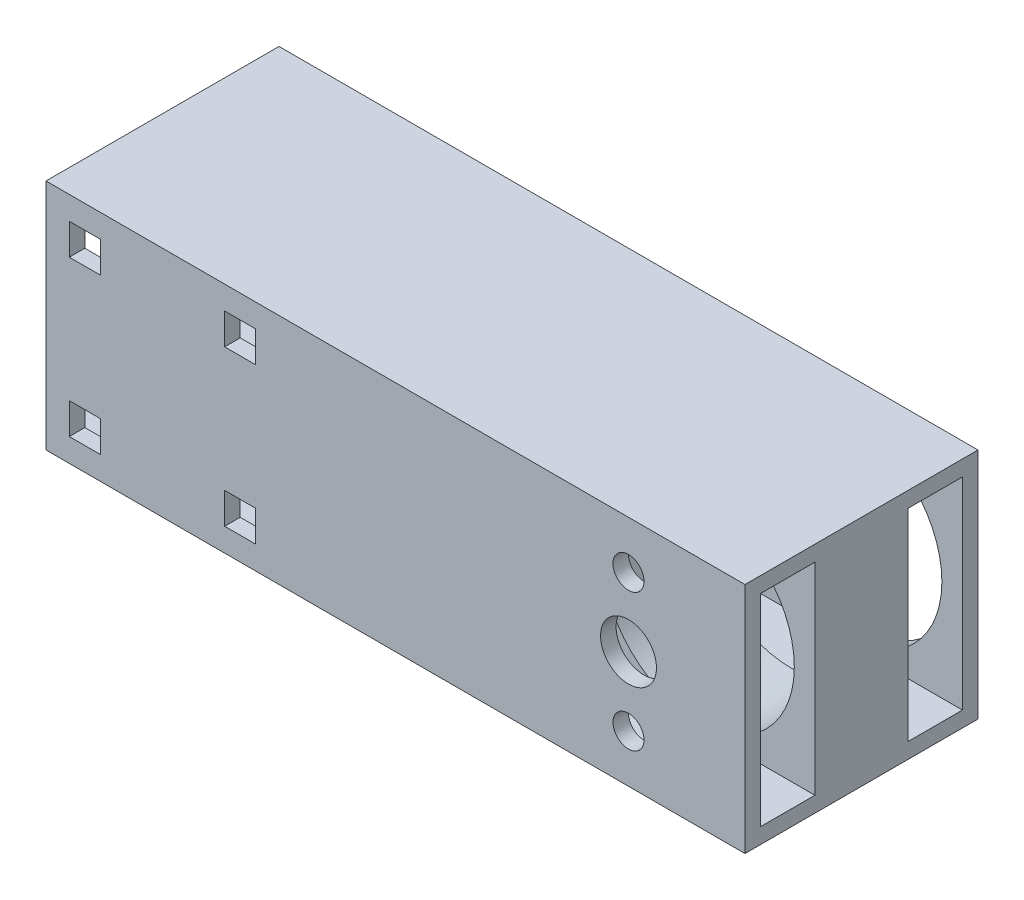
from build123d import *

# Parameters (mm, degrees)
SKETCH1_W           = 30
SKETCH1_H           = 30
SKETCH1_W_2         = 7
SKETCH1_H_2         = 26
BOSS_EXTRUDE3_DEPTH = 90
SKETCH6_R           = 12.35
CUT_EXTRUDE5_DEPTH  = 23
SKETCH8_R           = 3.6
SKETCH8_R_2         = 2
CUT_EXTRUDE6_DEPTH  = 17
SKETCH9_W           = 12
SKETCH9_H           = 26
CUT_EXTRUDE7_DEPTH  = 59
SKETCH10_W          = 4
SKETCH10_H          = 4
CUT_EXTRUDE8_DEPTH  = 34


with BuildPart() as part:
    # Sketch1 → Boss-Extrude3 (new body)
    with BuildSketch(Plane(origin=(0, 0, 0), x_dir=(0, 0, -1), z_dir=(1, 0, 0))):
        Rectangle(SKETCH1_W, SKETCH1_H)
        with Locations((-9.5, 0)):
            Rectangle(SKETCH1_W_2, SKETCH1_H_2, mode=Mode.SUBTRACT)
        with Locations((9.5, 0)):
            Rectangle(SKETCH1_W_2, SKETCH1_H_2, mode=Mode.SUBTRACT)
    extrude(amount=BOSS_EXTRUDE3_DEPTH)

    # Sketch6 → Cut-Extrude5 (cut)
    with BuildSketch(Plane(origin=(0, 0, -15), x_dir=(-1, 0, 0), z_dir=(0, 0, -1))):
        with Locations((-75, 0)):
            Circle(SKETCH6_R)
    extrude(amount=-CUT_EXTRUDE5_DEPTH, mode=Mode.SUBTRACT)

    # Sketch8 → Cut-Extrude6 (cut)
    with BuildSketch(Plane.XY.offset(15)):
        with Locations((75, 0)):
            Circle(SKETCH8_R)
        with Locations((75, 8.85)):
            Circle(SKETCH8_R_2)
        with Locations((75, -8.85)):
            Circle(SKETCH8_R_2)
    extrude(amount=-CUT_EXTRUDE6_DEPTH, mode=Mode.SUBTRACT)

    # Sketch9 → Cut-Extrude7 (cut)
    with BuildSketch(Plane.ZY):
        Rectangle(SKETCH9_W, SKETCH9_H)
    extrude(amount=-CUT_EXTRUDE7_DEPTH, mode=Mode.SUBTRACT)

    # Sketch10 → Cut-Extrude8 (cut)
    with BuildSketch(Plane(origin=(0, 0, -15), x_dir=(-1, 0, 0), z_dir=(0, 0, -1))):
        with Locations((-5, 10)):
            Rectangle(SKETCH10_W, SKETCH10_H)
        with Locations((-25, 10)):
            Rectangle(SKETCH10_W, SKETCH10_H)
        with Locations((-25, -10)):
            Rectangle(SKETCH10_W, SKETCH10_H)
        with Locations((-5, -10)):
            Rectangle(SKETCH10_W, SKETCH10_H)
    extrude(amount=-CUT_EXTRUDE8_DEPTH, mode=Mode.SUBTRACT)


solid = part.part
